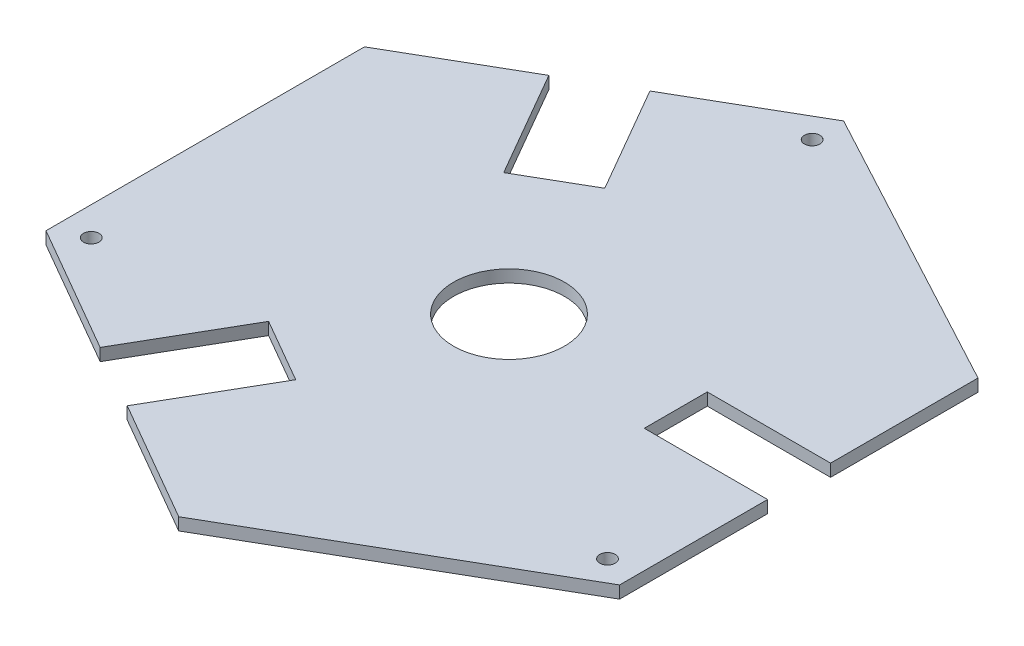
from build123d import *

# Parameters (mm, degrees)
BOSS_EXTRUDE1_DEPTH = 15.5
CUT_EXTRUDE1_DEPTH  = 24
CUT_EXTRUDE2_DEPTH  = 13.5
CUT_EXTRUDE3_DEPTH  = 13.5
CUT_EXTRUDE4_DEPTH  = 13.5
SKETCH6_R           = 1.15
CUT_EXTRUDE5_DEPTH  = 10.5
SKETCH8_W           = 5
SKETCH8_H           = 2
CUT_EXTRUDE7_DEPTH  = 5.5
SKETCH9_W           = 5
SKETCH9_H           = 2
CUT_EXTRUDE8_DEPTH  = 5.5
SKETCH10_W          = 5
SKETCH10_H          = 2
CUT_EXTRUDE9_DEPTH  = 5.5
CUT_EXTRUDE10_DEPTH = 20
BOSS_EXTRUDE2_DEPTH = 13.5
BOSS_EXTRUDE3_DEPTH = 13.5
SKETCH15_R          = 1.25
CUT_EXTRUDE11_DEPTH = 8.5
SKETCH16_W          = 5
SKETCH16_H          = 2.5
CUT_EXTRUDE12_DEPTH = 5.5
SKETCH17_W          = 5
SKETCH17_H          = 3
CUT_EXTRUDE13_DEPTH = 5.5
SKETCH18_W          = 5
SKETCH18_H          = 3
CUT_EXTRUDE14_DEPTH = 5.5
SKETCH19_W          = 17.5
SKETCH19_H          = 2
CUT_EXTRUDE15_DEPTH = 13.5
BOSS_EXTRUDE4_START = 2
SKETCH20_R          = 1.25
SKETCH20_R_2        = 9
BOSS_EXTRUDE4_DEPTH = 2
CUT_EXTRUDE17_DEPTH = 15.5
SKETCH24_W          = 53.333492709
SKETCH24_H          = 15.5
CUT_EXTRUDE18_DEPTH = 15.5


with BuildPart() as part:
    # Sketch1 → Boss-Extrude1 (new body)
    with BuildSketch(Plane(origin=(0, 0, 0), x_dir=(1, 0, 0), z_dir=(0, 1, 0))):
        Polygon((127, 0), (-63.5, 109.985226281), (-63.5, -109.985226281), align=None)
    extrude(amount=BOSS_EXTRUDE1_DEPTH)

    # Sketch2 → Cut-Extrude1 (cut)
    with BuildSketch(Plane(origin=(0, 15.5, 0), x_dir=(1, 0, 0), z_dir=(0, 1, 0))):
        Polygon((-63.5, -109.985226281), (16.5, -63.797204745), (-63.5, -17.60918321), align=None)
        Polygon((-63.5, 109.985226281), (16.5, 63.797204745), (-63.5, 17.60918321), align=None)
        Polygon((127, 0), (47, 46.188021535), (47, -46.188021535), align=None)
    extrude(amount=-CUT_EXTRUDE1_DEPTH, mode=Mode.SUBTRACT)

    # Sketch3 → Cut-Extrude2 (cut)
    with BuildSketch(Plane(origin=(0, 15.5, 0), x_dir=(1, 0, 0), z_dir=(0, 1, 0))):
        Polygon((21, 28.217265235), (21, 13.217265235), (16.2, 13.217265235), (16.2, 11.217265235), (21, 11.217265235), (21, 8.217265235), (27, 8.217265235), (27, 0), (45, 0), (46.5, 0), (46.5, 21.217265235), (46.5, 25.017265235), (45, 25.017265235), (45, 28.217265235), align=None)
        Polygon((13.936868519, -32.295166097), (0.946487462, -24.795166097), (3.346487462, -20.638244159), (1.614436654, -19.638244159), (-0.785563346, -23.795166097), (-3.383639557, -22.295166097), (-6.383639557, -27.49131852), (-13.5, -23.382685902), (-22.5, -38.97114317), (-23.25, -40.270181276), (-4.875309308, -50.878813893), (-1.584412773, -52.778813893), (-0.834412773, -51.479775788), (1.936868519, -53.079775788), align=None)
        Polygon((-35.53503876, 3.732547112), (-22.544657703, 11.232547112), (-20.144657703, 7.075625174), (-17.814436654, 8.420978924), (-20.214436654, 12.577900862), (-17.616360443, 14.077900862), (-20.616360443, 19.274053285), (-13.5, 23.382685902), (-22.5, 38.97114317), (-23.25, 40.270181276), (-41.624690692, 29.661548659), (-45.513757468, 27.416194909), (-44.763757468, 26.117156803), (-47.53503876, 24.517156803), align=None)
    extrude(amount=-CUT_EXTRUDE2_DEPTH, mode=Mode.SUBTRACT)

    # Sketch4 → Cut-Extrude3 (cut)
    with BuildSketch(Plane(origin=(0, 15.5, 0), x_dir=(1, 0, 0), z_dir=(0, 1, 0))):
        Polygon((3.668919326, -54.079775788), (16.5, -61.487803669), (35, -50.806823689), (45, -33.486315613), (45, -5.809475019), (46.5, 0), (44.5, 0), (44.5, -2), (25, -2), (25, 6.217265235), (19, 6.217265235), (19, 9.217265235), (14.2, 9.217265235), (14.2, 15.217265235), (19, 15.217265235), (19, 30.217265235), (45, 30.217265235), (45, 45.033320997), (26.5, 55.714300977), (6.5, 55.714300977), (-17.468847051, 41.87588068), (-23.25, 40.270181276), (-22.25, 38.538130468), (-20.517949192, 39.538130468), (-10.767949192, 22.650635095), (-17.884309636, 18.542002477), (-14.884309636, 13.345850054), (-17.482385847, 11.845850054), (-15.082385847, 7.688928116), (-20.876708511, 4.343574367), (-23.276708511, 8.500496305), (-36.267089568, 1.000496305), (-49.267089568, 23.517156803), (-61.5, 16.454482672), (-61.5, -4.907477288), (-51.5, -22.227985364), (-27.531152949, -36.066405661), (-23.25, -40.270181276), (-22.25, -38.538130468), (-23.982050808, -37.538130468), (-14.232050808, -20.650635095), (-7.115690364, -24.759267712), (-4.115690364, -19.563115289), (-1.517614153, -21.063115289), (0.882385847, -16.906193351), (6.07853827, -19.906193351), (3.67853827, -24.063115289), (16.668919326, -31.563115289), align=None)
    extrude(amount=-CUT_EXTRUDE3_DEPTH, mode=Mode.SUBTRACT)

    # Sketch5 → Cut-Extrude4 (cut)
    with BuildSketch(Plane(origin=(0, 2, 0), x_dir=(1, 0, 0), z_dir=(0, 1, 0))):
        Polygon((14.43375673, 0), (7.216878365, 12.5), (-7.216878365, 12.5), (-14.43375673, 0), (-7.216878365, -12.5), (7.216878365, -12.5), align=None)
    extrude(amount=-CUT_EXTRUDE4_DEPTH, mode=Mode.SUBTRACT)

    # Sketch6 → Cut-Extrude5 (cut)
    with BuildSketch(Plane(origin=(0, 15.5, 0), x_dir=(1, 0, 0), z_dir=(0, 1, 0))):
        with Locations((-59.125, -15.083275783)):
            Circle(SKETCH6_R)
        with Locations((16.5, 58.74538989)):
            Circle(SKETCH6_R)
        with Locations((42.625, -43.662114107)):
            Circle(SKETCH6_R)
    extrude(amount=-CUT_EXTRUDE5_DEPTH, mode=Mode.SUBTRACT)

    # Sketch8 → Cut-Extrude7 (cut)
    with BuildSketch(Plane(origin=(-48.25, 0, 27.857150488), x_dir=(-0.500000000000001, 0, -0.8660254037844382), z_dir=(0.8660254037844382, 0, -0.500000000000001))):
        with Locations((16.5, 5.1)):
            Rectangle(SKETCH8_W, SKETCH8_H)
    extrude(amount=-CUT_EXTRUDE7_DEPTH, mode=Mode.SUBTRACT)

    # Sketch9 → Cut-Extrude8 (cut)
    with BuildSketch(Plane(origin=(48.25, 0, 27.857150488), x_dir=(-0.4999999999999996, 0, 0.8660254037844389), z_dir=(-0.8660254037844389, 0, -0.4999999999999996))):
        with Locations((16.5, 5.1)):
            Rectangle(SKETCH9_W, SKETCH9_H)
    extrude(amount=-CUT_EXTRUDE8_DEPTH, mode=Mode.SUBTRACT)

    # Sketch10 → Cut-Extrude9 (cut)
    with BuildSketch(Plane.XY.offset(-55.714300977)):
        with Locations((16.5, 5.1)):
            Rectangle(SKETCH10_W, SKETCH10_H)
    extrude(amount=-CUT_EXTRUDE9_DEPTH, mode=Mode.SUBTRACT)

    # Sketch12 → Cut-Extrude10 (cut)
    with BuildSketch(Plane(origin=(0, 15.5, 0), x_dir=(1, 0, 0), z_dir=(0, 1, 0))):
        Polygon((-49.267089568, 23.517156803), (-49.267089568, -25.82655788), (-63.5, -17.60918321), (-63.5, 17.60918321), (-49.267089568, 25.82655788), align=None)
        Polygon((3.668919326, -54.079775788), (47, -29.062564697), (47, -46.188021535), (16.5, -63.797204745), (1.668919326, -55.234476326), align=None)
        Polygon((45, 30.217265235), (0, 54.270925304), (16.5, 63.797204745), (47, 46.188021535), (47, 29.062564697), align=None)
    extrude(amount=-CUT_EXTRUDE10_DEPTH, mode=Mode.SUBTRACT)

    # Sketch13 → Boss-Extrude2 (add)
    with BuildSketch(Plane(origin=(0, 2, 0), x_dir=(1, 0, 0), z_dir=(0, 1, 0))):
        Polygon((-49.267089568, -23.517156803), (-49.267089568, 23.517156803), (-47.267089568, 20.053055188), (-47.267089568, -24.671857341), align=None)
        Polygon((45, -30.217265235), (3.668919326, -54.079775788), (5.668919326, -50.615674173), (45, -27.907864158), align=None)
        Polygon((45, 30.217265235), (2.07703105, 53.160698663), (0.037424254, 51.98313113), (40.757379657, 30.217265235), align=None)
    extrude(amount=BOSS_EXTRUDE2_DEPTH)

    # Sketch14 → Boss-Extrude3 (add)
    with BuildSketch(Plane(origin=(0, 2, 0), x_dir=(1, 0, 0), z_dir=(0, 1, 0))):
        Polygon((-47.267089568, -24.671857341), (-36.767089568, -30.734035168), (-47.267089568, -12.547501688), align=None)
        Polygon((0.037424254, 51.98313113), (-10.462575746, 45.920953304), (10.730086226, 46.267627657), align=None)
        Polygon((45, -27.907864158), (45, -15.783508505), (34.5, -33.970041985), align=None)
    extrude(amount=BOSS_EXTRUDE3_DEPTH)

    # Sketch15 → Cut-Extrude11 (cut)
    with BuildSketch(Plane(origin=(0, 15.5, 0), x_dir=(1, 0, 0), z_dir=(0, 1, 0))):
        with Locations((-44.615165779, -23.140768428)):
            Circle(SKETCH15_R)
        with Locations((42.348076211, -26.376775245)):
            Circle(SKETCH15_R)
        with Locations((0.06687762, 49.09429048)):
            Circle(SKETCH15_R)
    extrude(amount=-CUT_EXTRUDE11_DEPTH, mode=Mode.SUBTRACT)

    # Sketch16 → Cut-Extrude12 (cut)
    with BuildSketch(Plane(origin=(-0.753783321, 0, -46.079771924), x_dir=(0.9998662310678192, 0, -0.01635603773028465), z_dir=(0.01635603773028465, 0, 0.9998662310678192))):
        with Locations((0.887657302, 11.25)):
            Rectangle(SKETCH16_W, SKETCH16_H)
    extrude(amount=-CUT_EXTRUDE12_DEPTH, mode=Mode.SUBTRACT)

    # Sketch17 → Cut-Extrude13 (cut)
    with BuildSketch(Plane(origin=(-40.883544784, 0, 23.604125586), x_dir=(-0.5000000000000001, 0, -0.8660254037844386), z_dir=(0.8660254037844386, 0, -0.5000000000000001))):
        with Locations((2.267089568, 11)):
            Rectangle(SKETCH17_W, SKETCH17_H)
    extrude(amount=-CUT_EXTRUDE13_DEPTH, mode=Mode.SUBTRACT)

    # Sketch18 → Cut-Extrude14 (cut)
    with BuildSketch(Plane(origin=(40.584459663, 0, 23.431448711), x_dir=(-0.5000000000000001, 0, 0.8660254037844386), z_dir=(-0.8660254037844386, 0, -0.5000000000000001))):
        with Locations((1.668919326, 11)):
            Rectangle(SKETCH18_W, SKETCH18_H)
    extrude(amount=-CUT_EXTRUDE14_DEPTH, mode=Mode.SUBTRACT)

    # Sketch19 → Cut-Extrude15 (cut)
    with BuildSketch(Plane(origin=(0, 15.5, 0), x_dir=(1, 0, 0), z_dir=(0, 1, 0))):
        Polygon((-13.5, -23.382685902), (-22.25, -38.538130468), (-23.982050808, -37.538130468), (-15.232050808, -22.382685902), align=None)
        Polygon((-13.5, 23.382685902), (-22.25, 38.538130468), (-20.517949192, 39.538130468), (-11.767949192, 24.382685902), align=None)
        with Locations((35.75, -1)):
            Rectangle(SKETCH19_W, SKETCH19_H)
    extrude(amount=-CUT_EXTRUDE15_DEPTH, mode=Mode.SUBTRACT)

    # Sketch20 → Boss-Extrude4 (add)
    with BuildSketch(Plane(origin=(0, 15.5, 0), x_dir=(1, 0, 0), z_dir=(0, 1, 0)).offset(BOSS_EXTRUDE4_START)):
        Polygon((1.668919326, -55.234476326), (47, -29.062564697), (47, -5.062564697), (27, -5.062564697), (27, 5.154700538), (47, 5.154700538), (47, 29.062564697), (0, 54.270925304), (-19.918584287, 42.770925304), (-9.918584287, 25.450417228), (-20.310889132, 19.450417228), (-30.310889132, 36.770925304), (-49.267089568, 25.82655788), (-49.267089568, -25.82655788), (-28.482479877, -37.82655788), (-18.482479877, -20.506049804), (-8.090175031, -26.506049804), (-18.090175031, -43.82655788), align=None)
        with Locations((-44.615165779, -23.140768428)):
            Circle(SKETCH20_R, mode=Mode.SUBTRACT)
        with Locations((0.06687762, 49.09429048)):
            Circle(SKETCH20_R, mode=Mode.SUBTRACT)
        with Locations((42.348076211, -26.376775245)):
            Circle(SKETCH20_R, mode=Mode.SUBTRACT)
        Circle(SKETCH20_R_2, mode=Mode.SUBTRACT)
    extrude(amount=-BOSS_EXTRUDE4_DEPTH)

    # Sketch21 → Cut-Extrude17 (cut)
    with BuildSketch(Plane.XZ):
        Polygon((1.668919326, 55.234476326), (47, 29.062564697), (47, -29.062564697), (0, -54.270925304), (-49.267089568, -25.82655788), (-49.267089568, 25.82655788), align=None)
    extrude(amount=-CUT_EXTRUDE17_DEPTH, mode=Mode.SUBTRACT)


with BuildPart() as cut_extrude17_piece_1:
    # of the separate pieces the step leaves, piece 1, a body of its own (cut_extrude17_pieces)
    add(part.part.solids().sort_by_distance((47, 17.5, -29.062564697))[0])


with BuildPart() as cut_extrude17_piece_2:
    # of the separate pieces the step leaves, piece 2, a body of its own (cut_extrude17_pieces)
    add(part.part.solids().sort_by_distance((47, 0, -29.062564697))[0])

    # Sketch24 → Cut-Extrude18 (cut)
    with BuildSketch(Plane(origin=(22.605266714, 0, -42.146633496), x_dir=(0.8812473665793996, 0, 0.47265534895616407), z_dir=(-0.47265534895616407, 0, 0.8812473665793996))):
        with Locations((1.015303216, 7.75)):
            Rectangle(SKETCH24_W, SKETCH24_H)
    extrude(amount=-CUT_EXTRUDE18_DEPTH, mode=Mode.SUBTRACT)


solid = cut_extrude17_piece_1.part
